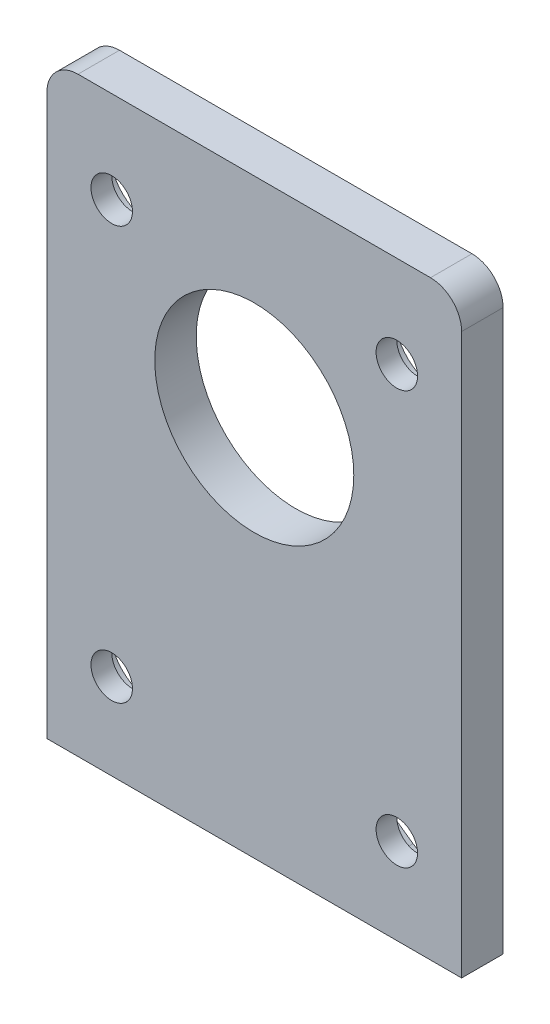
from build123d import *

# Parameters (mm, degrees)
SKETCH1_R           = 4.2
SKETCH1_R_2         = 9.6
BOSS_EXTRUDE1_DEPTH = 2
SKETCH2_W           = 40
SKETCH2_H           = 2
CUT_EXTRUDE1_DEPTH  = 1
SKETCH4_R           = 2
SKETCH4_R_2         = 9.6
BOSS_EXTRUDE3_DEPTH = 2


with BuildPart() as part:
    # Sketch1 → Boss-Extrude1 (new body)
    with BuildSketch(Plane.XY):
        with BuildLine():
            Line((-20, -29), (20, -29))
            Line((20, -29), (20, 26))
            ThreePointArc((20, 26), (19.121320344, 28.121320344), (17, 29))
            Line((17, 29), (-17, 29))
            ThreePointArc((-17, 29), (-19.121320344, 28.121320344), (-20, 26))
            Line((-20, 26), (-20, -29))
        make_face()
        with Locations((-13.75, -19.7)):
            Circle(SKETCH1_R, mode=Mode.SUBTRACT)
        with Locations((-5.725, -6.1)):
            Circle(SKETCH1_R, mode=Mode.SUBTRACT)
        with BuildLine():
            ThreePointArc((16.186, -16.278610808), (17.171389192, -22.136), (11.314, -23.121389192))
            Line((11.314, -23.121389192), (7.240917629, -20.221389192))
            ThreePointArc((7.240917629, -20.221389192), (6.255528438, -14.364), (12.112917629, -13.378610808))
            Line((12.112917629, -13.378610808), (16.186, -16.278610808))
        make_face(mode=Mode.SUBTRACT)
        with Locations((5.725, -6.1)):
            Circle(SKETCH1_R, mode=Mode.SUBTRACT)
        with Locations((-13.75, 20.15)):
            Circle(SKETCH1_R, mode=Mode.SUBTRACT)
        with Locations((0, 8.8)):
            Circle(SKETCH1_R_2, mode=Mode.SUBTRACT)
        with Locations((13.75, 20.15)):
            Circle(SKETCH1_R, mode=Mode.SUBTRACT)
    extrude(amount=BOSS_EXTRUDE1_DEPTH)

    # Sketch2 → Cut-Extrude1 (cut)
    with BuildSketch(Plane.XZ.offset(29)):
        with Locations((0, 1)):
            Rectangle(SKETCH2_W, SKETCH2_H)
    extrude(amount=-CUT_EXTRUDE1_DEPTH, mode=Mode.SUBTRACT)

    # Sketch4 → Boss-Extrude3 (add)
    with BuildSketch(Plane.XY.offset(2)):
        with BuildLine():
            Line((-17, 29), (17, 29))
            ThreePointArc((17, 29), (19.121320344, 28.121320344), (20, 26))
            Line((20, 26), (20, -28))
            Line((20, -28), (-20, -28))
            Line((-20, -28), (-20, 26))
            ThreePointArc((-20, 26), (-19.121320344, 28.121320344), (-17, 29))
        make_face()
        with Locations((-13.75, -19.7)):
            Circle(SKETCH4_R, mode=Mode.SUBTRACT)
        with Locations((-13.75, 20.15)):
            Circle(SKETCH4_R, mode=Mode.SUBTRACT)
        with Locations((13.75, 20.15)):
            Circle(SKETCH4_R, mode=Mode.SUBTRACT)
        with Locations((13.75, -19.7)):
            Circle(SKETCH4_R, mode=Mode.SUBTRACT)
        with Locations((0, 8.8)):
            Circle(SKETCH4_R_2, mode=Mode.SUBTRACT)
    extrude(amount=BOSS_EXTRUDE3_DEPTH)


solid = part.part
